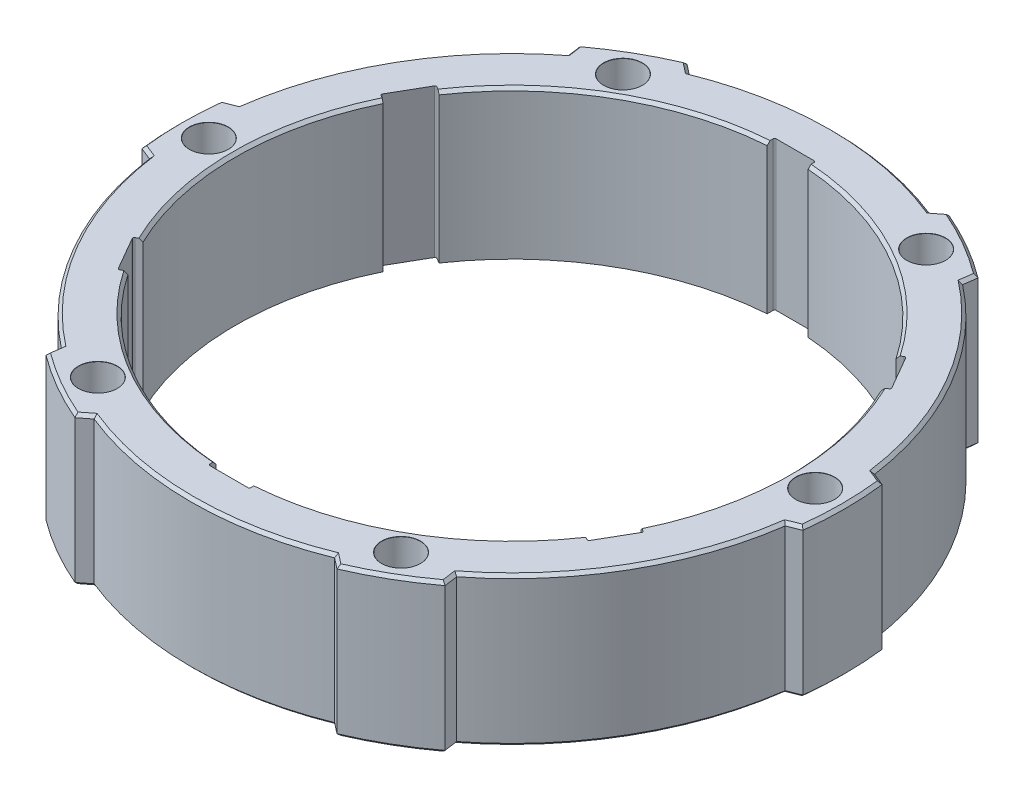
from build123d import *

# Parameters (mm, degrees)
BODY_SKETCH_R                           = 56
BODY_SKETCH_R_2                         = 46.5
BODY_DEPTH                              = 25
SIDE_CUTOUTS_DEPTH                      = 84.04817878797824
DRIVING_CUTOUT_DEPTH                    = 84.04817878797824
DRIVING_CUTOUT_FILLET_R                 = 0.25
MAIN_PATTERN_COUNT                      = 6
DRIVING_CUTOUT_FILLET_OF_MAIN_PATTERN_R = 0.25
OVERALL_CHAMFER_SIZE                    = 0.5


with BuildPart() as part:
    # body_sketch → body (new body)
    with BuildSketch(Plane(origin=(0, 0, 0), x_dir=(1, 0, 0), z_dir=(0, 1, 0))):
        Circle(BODY_SKETCH_R)
        Circle(BODY_SKETCH_R_2, mode=Mode.SUBTRACT)
    extrude(amount=BODY_DEPTH)

    # Sketch4 → spring_screw_hole (revolve, cut)
    with BuildSketch(Plane(origin=(51, 25, 0), x_dir=(0, 0, 1), z_dir=(1, 0, 0))):
        Polygon((0, 0), (-6.12e-15, 25), (1.6999999999999937, 25), (1.6999999999999953, 20), (3.249999999999998, 20), (3.2499999999999996, 0.02500000000000014), (3.2750000000000004, -3.47e-15), align=None)
    spring_screw_hole = revolve(axis=Axis((51, 31.34999999999999, 0), (0, -1, 0)), mode=Mode.SUBTRACT)

    # Sketch5 → side_cutouts (cut, through all)
    with BuildSketch(Plane(origin=(0, 25, 0), x_dir=(1, 0, 0), z_dir=(0, 1, 0))):
        with BuildLine():
            Line((53.474475712044786, 7.515347451843559), (55.60311783449049, 6.655320208958086))
            ThreePointArc((55.60311783449049, 6.655320208958086), (48.49742261192851, 28.000000000000078), (33.56523528852276, 44.826052469809404))
            Line((33.56523528852276, 44.826052469809404), (33.24571966758543, 42.55258069476307))
            ThreePointArc((33.24571966758543, 42.55258069476307), (46.76537180435964, 27.000000000000075), (53.474475712044786, 7.515347451843559))
        make_face()
    side_cutouts = extrude(amount=-SIDE_CUTOUTS_DEPTH, mode=Mode.SUBTRACT)

    # Sketch6 → driving_cutout (cut, through all)
    with BuildSketch(Plane(origin=(0, 25, 0), x_dir=(1, 0, 0), z_dir=(0, 1, 0))):
        Polygon((41.88246812850031, 20.201704469305465), (38.43642333441421, 26.17042913782078), (39.518955089144754, 26.795429137820783), (42.96499988323085, 20.82670446930547), align=None)
    driving_cutout = extrude(amount=-DRIVING_CUTOUT_DEPTH, mode=Mode.SUBTRACT)

    # driving_cutout_fillet
    driving_cutout_fillet_edges = [part.edges().sort_by_distance(p)[0] for p in [
        (42.96499988323085, 12.5, -20.82670446930547),
        (39.518955089144754, 12.5, -26.795429137820783),
    ]]
    fillet(driving_cutout_fillet_edges, radius=DRIVING_CUTOUT_FILLET_R)

    # main_pattern: spring_screw_hole, side_cutouts, driving_cutout ×6 about axis
    main_pattern_axis = Axis((0, 25, 0), (0, 1, 0))
    add([spring_screw_hole.rotate(main_pattern_axis, i * 360 / MAIN_PATTERN_COUNT) for i in range(1, MAIN_PATTERN_COUNT)], mode=Mode.SUBTRACT)
    add([side_cutouts.rotate(main_pattern_axis, i * 360 / MAIN_PATTERN_COUNT) for i in range(1, MAIN_PATTERN_COUNT)], mode=Mode.SUBTRACT)
    add([driving_cutout.rotate(main_pattern_axis, i * 360 / MAIN_PATTERN_COUNT) for i in range(1, MAIN_PATTERN_COUNT)], mode=Mode.SUBTRACT)

    # driving_cutout_fillet of main_pattern
    driving_cutout_fillet_of_main_pattern_edges = [part.edges().sort_by_distance(p)[0] for p in [
        (3.4460447940859886, 12.5, -47.62213360712609),
        (-3.4460447940861734, 12.5, -47.622133607126074),
        (-39.51895508914485, 12.5, -26.795429137820634),
        (-42.96499988323093, 12.5, -20.826704469305298),
        (-42.96499988323085, 12.5, 20.826704469305465),
        (-39.518955089144754, 12.5, 26.79542913782078),
        (-3.44604479408601, 12.5, 47.62213360712609),
        (3.4460447940861556, 12.5, 47.622133607126074),
        (39.51895508914487, 12.5, 26.79542913782062),
        (42.96499988323093, 12.5, 20.826704469305284),
    ]]
    fillet(driving_cutout_fillet_of_main_pattern_edges, radius=DRIVING_CUTOUT_FILLET_OF_MAIN_PATTERN_R)

    # overall_chamfer
    overall_chamfer_edges = [part.edges().sort_by_distance(p)[0] for p in [
        (46.765371804359646, 0, -27.000000000000057),
        (54.53879677326764, -3.55e-15, -7.085333830400822),
        (56, 0, 9.8765e-13),
        (54.53879677326766, 0, 7.085333830400643),
        (46.76537180435972, 0, 26.999999999999932),
        (33.405477478054245, 0, 43.689316582286125),
        (28.00000000000015, 0, 48.49742261192847),
        (21.13331929521354, -3.55e-15, 50.77465041268691),
        (3.77e-14, 0, 53.99999999999999),
        (-21.133319295213433, -3.55e-15, 50.774650412686945),
        (-27.99999999999979, 0, 48.497422611928684),
        (-33.4054774780541, -3.55e-15, 43.68931658228623),
        (-46.76537180435966, 0, 27.00000000000005),
        (-54.53879677326765, -3.55e-15, 7.085333830400819),
        (-56, 0, 1.38556e-12),
        (-54.53879677326766, -3.55e-15, -7.085333830400662),
        (-46.76537180435971, 0, -26.99999999999995),
        (-33.40547747805422, -3.55e-15, -43.68931658228614),
        (-28.000000000000078, 0, -48.49742261192851),
        (-21.133319295213553, 0, -50.77465041268689),
        (-5.902e-14, 0, -53.99999999999999),
        (21.133319295213415, 1.78e-15, -50.77465041268696),
        (33.405477478054095, 0, -43.68931658228624),
        (27.99999999999978, 0, -48.49742261192869),
        (33.40547747805424, 25, 43.689316582286125),
        (28.00000000000007, 25, 48.49742261192853),
        (21.13331929521354, 25, 50.774650412686896),
        (4.619e-14, 25, 53.99999999999999),
        (-21.13331929521343, 25, 50.77465041268694),
        (-27.999999999999936, 25, 48.497422611928606),
        (-33.4054774780541, 25, 43.68931658228623),
        (-46.765371804359646, 25, 27.000000000000057),
        (-54.538796773267634, 25, 7.085333830400815),
        (-56, 25, 9.415e-14),
        (-54.538796773267656, 25, -7.085333830400664),
        (-46.76537180435972, 25, -26.999999999999936),
        (-33.40547747805422, 25, -43.68931658228614),
        (-28.00000000000006, 25, -48.49742261192853),
        (-21.133319295213557, 25, -50.77465041268689),
        (-7.105e-14, 25, -54),
        (21.13331929521341, 25, -50.77465041268695),
        (27.99999999999993, 25, -48.49742261192861),
        (33.405477478054095, 25, -43.68931658228624),
        (46.765371804359646, 25, -27.000000000000064),
        (54.538796773267634, 25, -7.085333830400822),
        (56, 25, -8.882e-14),
        (54.53879677326766, 25, 7.085333830400643),
        (46.765371804359724, 25, 26.99999999999993),
        (-46.5, 25, 9.592e-14),
        (-23.24999999999993, 25, 40.27018127597644),
        (23.250000000000075, 25, 40.27018127597636),
        (46.5, 25, -9.592e-14),
        (23.24999999999989, 25, -40.27018127597647),
        (-23.250000000000068, 25, -40.27018127597637),
    ]]
    chamfer(overall_chamfer_edges, length=OVERALL_CHAMFER_SIZE)


solid = part.part
